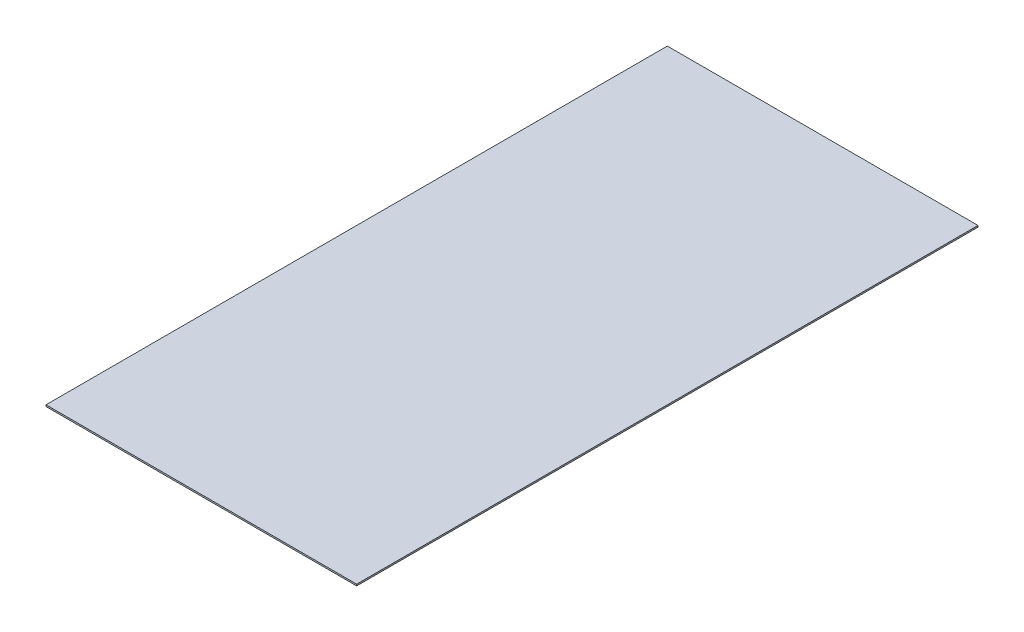
from build123d import *

# Parameters (mm, degrees)
SKETCH1_W          = 508
SKETCH1_H          = 1016
GROUND_PLANE_DEPTH = 2.54


with BuildPart() as part:
    # Sketch1 → Ground Plane (new body)
    with BuildSketch(Plane(origin=(0, 0, 0), x_dir=(1, 0, 0), z_dir=(0, 1, 0))):
        Rectangle(SKETCH1_W, SKETCH1_H)
    extrude(amount=GROUND_PLANE_DEPTH)


solid = part.part
